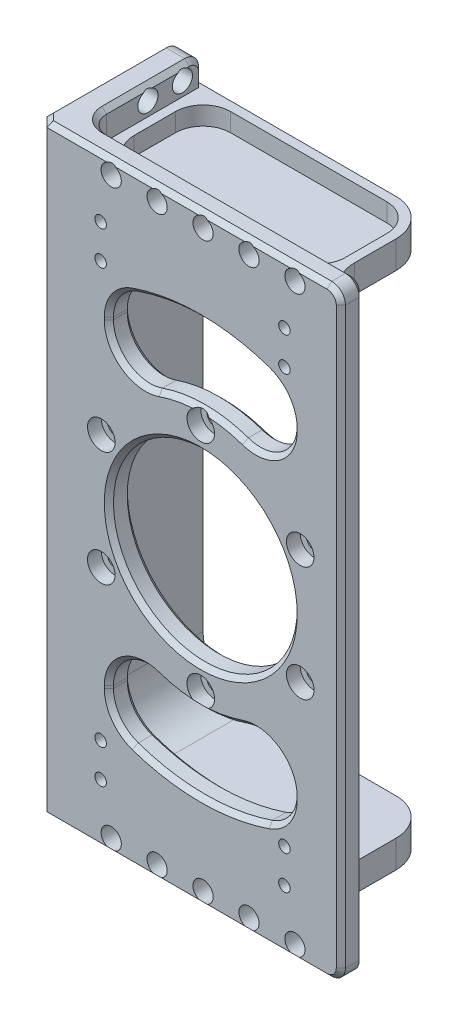
from build123d import *

# Parameters (mm, degrees)
SKETCH_1_W                  = 60
SKETCH_1_H                  = 131
EXTRUDE_1_DEPTH             = 5
SKETCH_2_W                  = 30
SKETCH_2_H                  = 131
EXTRUDE_2_DEPTH             = 6
SKETCH_3_R                  = 20
CUT_EXTRUDE_1_DEPTH         = 10
CHAMFER_1_SIZE              = 2
FILLET_1_R                  = 3
SKETCH_13_R                 = 1.6
CUT_EXTRUDE_2_DEPTH         = 6
SKETCH_14_R                 = 3
CUT_EXTRUDE_3_DEPTH         = 3
CHAMFER_4_SIZE              = 1
SKETCH_16_W                 = 50
SKETCH_16_H                 = 6
EXTRUDE_4_DEPTH             = 25
FILLET_3_R                  = 4
FILLET_4_R                  = 10
FILLET_5_R                  = 8
CUT_EXTRUDE_4_DEPTH         = 4
FILLET_6_R                  = 6
SKETCH_19_R                 = 2.2
CUT_EXTRUDE_5_DEPTH         = 18
SKETCH_20_R                 = 2.2
CUT_EXTRUDE_6_DEPTH         = 18
HOLE_WIZARD_M3_1_AT_2_COUNT = 2
HOLE_WIZARD_M3_1_AT_2_PITCH = 40
HOLE_WIZARD_M3_1_AT_3_COUNT = 2
HOLE_WIZARD_M3_1_AT_3_PITCH = 105.617529322
HOLE_WIZARD_M3_1_AT_4_COUNT = 2
HOLE_WIZARD_M3_1_AT_4_PITCH = 97.75
HOLE_WIZARD_M3_2_D          = 2.5
HOLE_WIZARD_M3_2_DEPTH      = 7.5
HOLE_WIZARD_M3_2_TIP        = 0.751075774
CUT_EXTRUDE_7_DEPTH         = 10
FILLET_7_R                  = 8
CHAMFER_5_SIZE              = 1
CHAMFER_6_SIZE              = 1


# Some blends are built 0.0001 mm under size
with BuildPart() as part:
    # 草图1 → 凸台-拉伸1 (new body)
    with BuildSketch(Plane.XY):
        with Locations((-207.175860782, 60.5)):
            Rectangle(SKETCH_1_W, SKETCH_1_H)
    extrude(amount=EXTRUDE_1_DEPTH)

    # 草图2 → 凸台-拉伸2 (add)
    with BuildSketch(Plane.ZY.offset(237.175860782)):
        with Locations((-10, 60.5)):
            Rectangle(SKETCH_2_W, SKETCH_2_H)
    extrude(amount=EXTRUDE_2_DEPTH)

    # 草图3 → 切除-拉伸1 (cut)
    with BuildSketch(Plane.XY.offset(5)):
        with Locations((-207.675860782, 60.5)):
            Circle(SKETCH_3_R)
    extrude(amount=-CUT_EXTRUDE_1_DEPTH, mode=Mode.SUBTRACT)

    # 倒角1
    chamfer_1_edges = [part.edges().sort_by_distance(p)[0] for p in [
        (-243.175860782, 60.5, 5),
    ]]
    chamfer(chamfer_1_edges, length=CHAMFER_1_SIZE)

    # 圆角1
    fillet_1_edges = [part.edges().sort_by_distance(p)[0] for p in [
        (-240.175860782, 126, -25),
        (-240.175860782, -5, -25),
        (-177.175860782, 126, 2.5),
        (-177.175860782, -5, 2.5),
    ]]
    fillet(fillet_1_edges, radius=FILLET_1_R)

    # 草图13 → 切除-拉伸2 (cut)
    with BuildSketch(Plane.XY.offset(5)):
        with Locations((-207.675860782, 85.5)):
            Circle(SKETCH_13_R)
        with Locations((-229.326495877, 73)):
            Circle(SKETCH_13_R)
        with Locations((-186.025225688, 73)):
            Circle(SKETCH_13_R)
        with Locations((-186.025225688, 48)):
            Circle(SKETCH_13_R)
        with Locations((-207.675860782, 35.5)):
            Circle(SKETCH_13_R)
        with Locations((-229.326495877, 48)):
            Circle(SKETCH_13_R)
    extrude(amount=-CUT_EXTRUDE_2_DEPTH, mode=Mode.SUBTRACT)

    # 草图14 → 切除-拉伸3 (cut)
    with BuildSketch(Plane.XY.offset(5)):
        with Locations((-207.675860782, 85.5)):
            Circle(SKETCH_14_R)
        with Locations((-186.025225688, 73)):
            Circle(SKETCH_14_R)
        with Locations((-186.025225688, 48)):
            Circle(SKETCH_14_R)
        with Locations((-207.675860782, 35.5)):
            Circle(SKETCH_14_R)
        with Locations((-229.326495877, 48)):
            Circle(SKETCH_14_R)
        with Locations((-229.326495877, 73)):
            Circle(SKETCH_14_R)
    extrude(amount=-CUT_EXTRUDE_3_DEPTH, mode=Mode.SUBTRACT)

    # 倒角4
    chamfer_4_edges = [part.edges().sort_by_distance(p)[0] for p in [
        (-243.175860782, 126, -9.5),
        (-242.175860782, 126, 4),
        (-210.675860782, -5, 5),
        (-242.175860782, -5, 4),
        (-243.175860782, 60.5, -25),
        (-210.675860782, 126, 5),
        (-243.175860782, -5, -9.5),
        (-243.175860782, -4.121320344, -24.121320344),
        (-243.175860782, 125.121320344, -24.121320344),
        (-177.175860782, 60.5, 5),
        (-178.054540439, -4.121320344, 5),
        (-178.054540439, 125.121320344, 5),
    ]]
    chamfer(chamfer_4_edges, length=CHAMFER_4_SIZE)

    # 草图16 → 凸台-拉伸4 (add)
    with BuildSketch(Plane(origin=(0, 0, 0), x_dir=(-1, 0, 0), z_dir=(0, 0, -1))):
        with Locations((212.175860782, 117)):
            Rectangle(SKETCH_16_W, SKETCH_16_H)
    extrude_4 = extrude(amount=EXTRUDE_4_DEPTH)

    # 镜向1: 凸台-拉伸4 across plane
    add(extrude_4.mirror(Plane(origin=(0, 60.5, 0), x_dir=(0, 0, 1), z_dir=(0, -1, 0))))

    # 圆角3
    fillet_3_edges = [part.edges().sort_by_distance(p)[0] for p in [
        (-237.175860782, -2, 0),
        (-237.175860782, 123, 0),
    ]]
    fillet(fillet_3_edges, radius=FILLET_3_R)

    # 圆角4
    fillet_4_edges = [part.edges().sort_by_distance(p)[0] for p in [
        (-237.175860782, 114, -12.5),
        (-237.175860782, 7, -12.5),
    ]]
    fillet(fillet_4_edges, radius=FILLET_4_R)

    # 圆角5
    fillet_5_edges = [part.edges().sort_by_distance(p)[0] for p in [
        (-187.175860782, 117, -25),
        (-187.175860782, 117, 0),
        (-187.175860782, 4, 0),
        (-187.175860782, 4, -25),
    ]]
    fillet(fillet_5_edges, radius=FILLET_5_R)

    # 草图17 → 切除-拉伸4 (cut)
    with BuildSketch(Plane(origin=(0, 120, 0), x_dir=(1, 0, 0), z_dir=(0, 1, 0))):
        with BuildLine():
            Line((-235.175860782, 4), (-235.175860782, 2))
            Line((-235.175860782, 2), (-233.175860782, 2))
            Line((-233.175860782, 2), (-187.175860782, 2))
            ThreePointArc((-187.175860782, 2), (-188.662693763, 4.83772234), (-189.175860782, 8))
            Line((-189.175860782, 8), (-189.175860782, 17))
            ThreePointArc((-189.175860782, 17), (-190.933220095, 21.242640687), (-195.175860782, 23))
            Line((-195.175860782, 23), (-235.175860782, 23))
            Line((-235.175860782, 23), (-235.175860782, 4))
        make_face()
    cut_extrude_4 = extrude(amount=-CUT_EXTRUDE_4_DEPTH, mode=Mode.SUBTRACT)

    # 镜向2: 切除-拉伸4 across plane
    add(cut_extrude_4.mirror(Plane(origin=(0, 60.5, 0), x_dir=(0, 0, 1), z_dir=(0, -1, 0))), mode=Mode.SUBTRACT)

    # 圆角6
    fillet_6_edges = [part.edges().sort_by_distance(p)[0] for p in [
        (-187.175860782, 118, -2),
        (-235.175860782, 118, -23),
        (-235.175860782, 118, -2),
        (-235.175860782, 3, -23),
        (-187.175860782, 3, -2),
        (-235.175860782, 3, -2),
    ]]
    fillet(fillet_6_edges, radius=FILLET_6_R - 0.0001)  # a hair under: the kernel refuses the full size

    # 草图19 → 切除-拉伸5 (cut)
    with BuildSketch(Plane.XY.offset(5)):
        with Locations((-217.175860782, -2)):
            Circle(SKETCH_19_R)
        with Locations((-187.175860782, -2)):
            Circle(SKETCH_19_R)
        with Locations((-197.175860782, -2)):
            Circle(SKETCH_19_R)
        with Locations((-207.175860782, -2)):
            Circle(SKETCH_19_R)
        with Locations((-227.175860782, -2)):
            Circle(SKETCH_19_R)
    cut_extrude_5 = extrude(amount=-CUT_EXTRUDE_5_DEPTH, mode=Mode.SUBTRACT)

    # 镜向3: 切除-拉伸5 across plane
    add(cut_extrude_5.mirror(Plane(origin=(0, 60.5, 0), x_dir=(0, 0, 1), z_dir=(0, -1, 0))), mode=Mode.SUBTRACT)

    # 草图20 → 切除-拉伸6 (cut)
    with BuildSketch(Plane.ZY.offset(243.175860782)):
        with Locations((-20.5, -2)):
            Circle(SKETCH_20_R)
        with Locations((-13, -2)):
            Circle(SKETCH_20_R)
    cut_extrude_6 = extrude(amount=-CUT_EXTRUDE_6_DEPTH, mode=Mode.SUBTRACT)

    # 镜向4: 切除-拉伸6 across plane
    add(cut_extrude_6.mirror(Plane(origin=(0, 60.5, 0), x_dir=(0, 0, 1), z_dir=(0, -1, 0))), mode=Mode.SUBTRACT)

    # 草图23 → M3 螺纹孔1 (revolve, cut)
    with BuildSketch(Plane(origin=(-229.465860782, 113.065, 5), x_dir=(0, -1, 0), z_dir=(1, 0, 0))):
        Polygon((0, 0), (0, 8.251075774), (1.25, 7.5), (1.25, 0), align=None)
    hole_wizard_m3_1 = revolve(axis=Axis((-229.465860782, 113.065, 11.35), (0, 0, -1)), mode=Mode.SUBTRACT)

    # M3 螺纹孔1 at 2: M3 螺纹孔1 ×2
    with Locations(*[(i * HOLE_WIZARD_M3_1_AT_2_PITCH, 0, 0) for i in range(1, HOLE_WIZARD_M3_1_AT_2_COUNT)]):
        add(hole_wizard_m3_1, mode=Mode.SUBTRACT)

    # M3 螺纹孔1 at 3: M3 螺纹孔1 ×2
    with Locations(*[Vector(0.3787250114344214, -0.9255092466928666, 0) * (i * HOLE_WIZARD_M3_1_AT_3_PITCH) for i in range(1, HOLE_WIZARD_M3_1_AT_3_COUNT)]):
        add(hole_wizard_m3_1, mode=Mode.SUBTRACT)

    # M3 螺纹孔1 at 4: M3 螺纹孔1 ×2
    with Locations(*[(0, -i * HOLE_WIZARD_M3_1_AT_4_PITCH, 0) for i in range(1, HOLE_WIZARD_M3_1_AT_4_COUNT)]):
        add(hole_wizard_m3_1, mode=Mode.SUBTRACT)

    # 镜向5: M3 螺纹孔1 across plane
    add(hole_wizard_m3_1.mirror(Plane(origin=(0, 60.5, 0), x_dir=(0, 0, 1), z_dir=(0, -1, 0))), mode=Mode.SUBTRACT)

    # 镜向5 copy 1 sketch → 镜向5 copy 1 (revolve, cut)
    with BuildSketch(Plane(origin=(-189.465860782, 7.935, 5), x_dir=(0, 1, 0), z_dir=(1, 0, 0))):
        Polygon((0, 0), (0, -8.251075774), (1.25, -7.5), (1.25, 0), align=None)
    revolve(axis=Axis((-189.465860782, 7.935, 11.35), (0, 0, 1)), mode=Mode.SUBTRACT)

    # 镜向5 copy 2 sketch → 镜向5 copy 2 (revolve, cut)
    with BuildSketch(Plane(origin=(-189.465860782, 105.685, 5), x_dir=(0, 1, 0), z_dir=(1, 0, 0))):
        Polygon((0, 0), (0, -8.251075774), (1.25, -7.5), (1.25, 0), align=None)
    revolve(axis=Axis((-189.465860782, 105.685, 11.35), (0, 0, 1)), mode=Mode.SUBTRACT)

    # 镜向5 copy 3 sketch → 镜向5 copy 3 (revolve, cut)
    with BuildSketch(Plane(origin=(-229.465860782, 105.685, 5), x_dir=(0, 1, 0), z_dir=(1, 0, 0))):
        Polygon((0, 0), (0, -8.251075774), (1.25, -7.5), (1.25, 0), align=None)
    revolve(axis=Axis((-229.465860782, 105.685, 11.35), (0, 0, 1)), mode=Mode.SUBTRACT)

    # M3 螺纹孔2
    with Locations(Plane.ZY.offset(243.175860782)):
        with Locations((-7.12, 85.8), (-7.12, 35.2)):
            Hole(HOLE_WIZARD_M3_2_D / 2, depth=HOLE_WIZARD_M3_2_DEPTH)
            with Locations((0, 0, -(HOLE_WIZARD_M3_2_DEPTH + HOLE_WIZARD_M3_2_TIP / 2))):  # 118° drill point
                Cone(0, HOLE_WIZARD_M3_2_D / 2, HOLE_WIZARD_M3_2_TIP, mode=Mode.SUBTRACT)

    # 草图27 → 切除-拉伸7 (cut)
    with BuildSketch(Plane(origin=(0, 0, 0), x_dir=(-1, 0, 0), z_dir=(0, 0, -1))):
        with BuildLine():
            Line((187.675860782, 100.811288741), (187.675860782, 80.803940504))
            ThreePointArc((187.675860782, 80.803940504), (207.675860782, 89), (227.675860782, 80.803940504))
            Line((227.675860782, 80.803940504), (227.675860782, 100.811288741))
            ThreePointArc((227.675860782, 100.811288741), (207.675860782, 105.5), (187.675860782, 100.811288741))
        make_face()
        with BuildLine():
            Line((187.675860782, 40.196059496), (187.675860782, 20.188711259))
            ThreePointArc((187.675860782, 20.188711259), (207.675860782, 15.5), (227.675860782, 20.188711259))
            Line((227.675860782, 20.188711259), (227.675860782, 40.196059496))
            ThreePointArc((227.675860782, 40.196059496), (207.675860782, 32), (187.675860782, 40.196059496))
        make_face()
    extrude(amount=-CUT_EXTRUDE_7_DEPTH, mode=Mode.SUBTRACT)

    # 圆角7
    fillet_7_edges = [part.edges().sort_by_distance(p)[0] for p in [
        (-227.675860782, 80.803940504, 2.5),
        (-187.675860782, 80.803940504, 2.5),
        (-187.675860782, 100.811288741, 2.5),
        (-227.675860782, 100.811288741, 2.5),
        (-227.675860782, 20.188711259, 2.5),
        (-187.675860782, 20.188711259, 2.5),
        (-187.675860782, 40.196059496, 2.5),
        (-227.675860782, 40.196059496, 2.5),
    ]]
    fillet(fillet_7_edges, radius=FILLET_7_R)

    # 倒角5
    # the kernel refuses this chamfer: 1 mm, written as the material it takes off along each edge
    with BuildSketch(Plane(origin=(-207.675860782, 60.5, 0), x_dir=(1, 0, 0), z_dir=(0, -1, 0))) as chamfer_5_piece_1:
        Polygon((20 + CHAMFER_5_SIZE, 0), (20, CHAMFER_5_SIZE), (20, 0), align=None)
    revolve(axis=Axis((-207.675860782, 60.5, 0), (0, 0, 1)), mode=Mode.SUBTRACT)
    with BuildSketch(Plane(origin=(-207.675860782, 60.5, 5), x_dir=(1, 0, 0), z_dir=(0, -1, 0))) as chamfer_5_piece_2:
        Polygon((20, -CHAMFER_5_SIZE), (20 + CHAMFER_5_SIZE, 0), (20, 0), align=None)
    revolve(axis=Axis((-207.675860782, 60.5, 5), (0, 0, 1)), mode=Mode.SUBTRACT)
    with BuildSketch(Plane(origin=(-207.675860782, 60.5, 5), x_dir=(0.3243243243243247, -0.9459459459459458, 0), z_dir=(0.9459459459459458, 0.3243243243243247, 0))) as chamfer_5_piece_3:
        Polygon((45, CHAMFER_5_SIZE), (45 + CHAMFER_5_SIZE, 0), (45, 0), align=None)
    revolve(axis=Axis((-207.675860782, 60.5, 5), (0, 0, -1)), revolution_arc=37.849288832, mode=Mode.SUBTRACT)
    with BuildSketch(Plane(origin=(-207.675860782, 60.5, 0), x_dir=(0.3243243243243247, -0.9459459459459458, 0), z_dir=(0.9459459459459458, 0.3243243243243247, 0))) as chamfer_5_piece_4:
        Polygon((45 + CHAMFER_5_SIZE, 0), (45, -CHAMFER_5_SIZE), (45, 0), align=None)
    revolve(axis=Axis((-207.675860782, 60.5, 0), (0, 0, -1)), revolution_arc=37.849288832, mode=Mode.SUBTRACT)
    with BuildSketch(Plane(origin=(-187.675860782, 26.028997694, 5), x_dir=(-0.02749587661058217, 0, -0.9996219169112968), z_dir=(0, -1, 0)), Plane(origin=(-187.675860782, 26.028997694, 0), x_dir=(0.9996219169112968, 0, -0.027495876610586483), z_dir=(0, -1, 0)), Plane(origin=(-227.675860782, 25.5, 5), x_dir=(0.02749587661058217, 0, -0.9996219169112968), z_dir=(0, 1, 0)), Plane(origin=(-227.675860782, 25.5, 0), x_dir=(-0.9996219169112968, 0, -0.027495876610586483), z_dir=(0, 1, 0)), Plane(origin=(-187.675860782, 95.5, 5), x_dir=(-0.02749587661058217, 0, -0.9996219169112968), z_dir=(0, -1, 0)), Plane(origin=(-187.675860782, 95.5, 0), x_dir=(0.9996219169112968, 0, -0.027495876610586483), z_dir=(0, -1, 0)), Plane(origin=(-227.675860782, 94.971002306, 5), x_dir=(0.02749587661058217, 0, -0.9996219169112968), z_dir=(0, 1, 0)), Plane(origin=(-227.675860782, 94.971002306, 0), x_dir=(-0.9996219169112968, 0, -0.027495876610586483), z_dir=(0, 1, 0))) as chamfer_5_piece_5:
        Polygon((CHAMFER_5_SIZE * 0.999621916911, CHAMFER_5_SIZE * 0.0274958766106), (-CHAMFER_5_SIZE * 0.0274958766106, CHAMFER_5_SIZE * 0.999621916911), (0, 0), align=None)
    extrude(amount=0.528997694, mode=Mode.SUBTRACT)
    with BuildSketch(Plane(origin=(-207.675860782, 60.5, 5), x_dir=(0.3287671232876714, -0.9444110220900375, 0), z_dir=(0.9444110220900375, 0.3287671232876714, 0))) as chamfer_5_piece_6:
        Polygon((28.5, CHAMFER_5_SIZE), (28.5 - CHAMFER_5_SIZE, 0), (28.5, 0), align=None)
    revolve(axis=Axis((-207.675860782, 60.5, 5), (0, 0, -1)), revolution_arc=38.387923948, mode=Mode.SUBTRACT)
    with BuildSketch(Plane(origin=(-207.675860782, 60.5, 0), x_dir=(-0.3287671232876714, -0.9444110220900375, 0), z_dir=(-0.9444110220900375, 0.3287671232876714, 0))) as chamfer_5_piece_7:
        Polygon((28.5 - CHAMFER_5_SIZE, 0), (28.5, CHAMFER_5_SIZE), (28.5, 0), align=None)
    revolve(axis=Axis((-207.675860782, 60.5, 0), (0, 0, 1)), revolution_arc=38.387923948, mode=Mode.SUBTRACT)
    with BuildSketch(Plane(origin=(-207.675860782, 60.5, 5), x_dir=(-0.3287671232876707, 0.9444110220900377, 0), z_dir=(-0.9444110220900377, -0.3287671232876707, 0))) as chamfer_5_piece_8:
        Polygon((28.5, CHAMFER_5_SIZE), (28.5 - CHAMFER_5_SIZE, 0), (28.5, 0), align=None)
    revolve(axis=Axis((-207.675860782, 60.5, 5), (0, 0, -1)), revolution_arc=38.387923948, mode=Mode.SUBTRACT)
    with BuildSketch(Plane(origin=(-207.675860782, 60.5, 0), x_dir=(0.3287671232876697, 0.944411022090038, 0), z_dir=(0.944411022090038, -0.3287671232876697, 0))) as chamfer_5_piece_9:
        Polygon((28.5 - CHAMFER_5_SIZE, 0), (28.5, CHAMFER_5_SIZE), (28.5, 0), align=None)
    revolve(axis=Axis((-207.675860782, 60.5, 0), (0, 0, 1)), revolution_arc=38.387923948, mode=Mode.SUBTRACT)
    with BuildSketch(Plane(origin=(-207.675860782, 60.5, 5), x_dir=(-0.32432432432432445, 0.9459459459459459, 0), z_dir=(-0.9459459459459459, -0.32432432432432445, 0))) as chamfer_5_piece_10:
        Polygon((45, CHAMFER_5_SIZE), (45 + CHAMFER_5_SIZE, 0), (45, 0), align=None)
    revolve(axis=Axis((-207.675860782, 60.5, 5), (0, 0, -1)), revolution_arc=37.849288832, mode=Mode.SUBTRACT)
    with BuildSketch(Plane(origin=(-207.675860782, 60.5, 0), x_dir=(-0.32432432432432434, 0.9459459459459459, 0), z_dir=(-0.9459459459459459, -0.32432432432432434, 0))) as chamfer_5_piece_11:
        Polygon((45 + CHAMFER_5_SIZE, 0), (45, -CHAMFER_5_SIZE), (45, 0), align=None)
    revolve(axis=Axis((-207.675860782, 60.5, 0), (0, 0, -1)), revolution_arc=37.849288832, mode=Mode.SUBTRACT)
    with BuildSketch(Plane(origin=(-195.675860782, 25.5, 0), x_dir=(1, 0, 0), z_dir=(0, 1, 0))) as chamfer_5_piece_12:
        Polygon((8 + CHAMFER_5_SIZE, 0), (8, -CHAMFER_5_SIZE), (8, 0), align=None)
    revolve(axis=Axis((-195.675860782, 25.5, 0), (0, 0, -1)), revolution_arc=71.075355584, mode=Mode.SUBTRACT)
    with BuildSketch(Plane(origin=(-195.675860782, 25.5, 5), x_dir=(1, 0, 0), z_dir=(0, 1, 0))) as chamfer_5_piece_13:
        Polygon((8, CHAMFER_5_SIZE), (8 + CHAMFER_5_SIZE, 0), (8, 0), align=None)
    revolve(axis=Axis((-195.675860782, 25.5, 5), (0, 0, -1)), revolution_arc=71.075355584, mode=Mode.SUBTRACT)
    with BuildSketch(Plane(origin=(-219.675860782, 26.028997694, 0), x_dir=(-1, 0, 0), z_dir=(0, -1, 0))) as chamfer_5_piece_14:
        Polygon((8 + CHAMFER_5_SIZE, 0), (8, -CHAMFER_5_SIZE), (8, 0), align=None)
    revolve(axis=Axis((-219.675860782, 26.028997694, 0), (0, 0, -1)), revolution_arc=109.193961974, mode=Mode.SUBTRACT)
    with BuildSketch(Plane(origin=(-219.675860782, 26.028997694, 5), x_dir=(-1, 0, 0), z_dir=(0, -1, 0))) as chamfer_5_piece_15:
        Polygon((8, CHAMFER_5_SIZE), (8 + CHAMFER_5_SIZE, 0), (8, 0), align=None)
    revolve(axis=Axis((-219.675860782, 26.028997694, 5), (0, 0, -1)), revolution_arc=109.193961974, mode=Mode.SUBTRACT)
    with BuildSketch(Plane(origin=(-219.675860782, 25.5, 0), x_dir=(-0.3243243243243228, -0.9459459459459465, 0), z_dir=(0.9459459459459465, -0.3243243243243228, 0))) as chamfer_5_piece_16:
        Polygon((8 + CHAMFER_5_SIZE, 0), (8, -CHAMFER_5_SIZE), (8, 0), align=None)
    revolve(axis=Axis((-219.675860782, 25.5, 0), (0, 0, -1)), revolution_arc=71.075355584, mode=Mode.SUBTRACT)
    with BuildSketch(Plane(origin=(-219.675860782, 25.5, 5), x_dir=(-0.3243243243243228, -0.9459459459459465, 0), z_dir=(0.9459459459459465, -0.3243243243243228, 0))) as chamfer_5_piece_17:
        Polygon((8, CHAMFER_5_SIZE), (8 + CHAMFER_5_SIZE, 0), (8, 0), align=None)
    revolve(axis=Axis((-219.675860782, 25.5, 5), (0, 0, -1)), revolution_arc=71.075355584, mode=Mode.SUBTRACT)
    with BuildSketch(Plane(origin=(-195.675860782, 26.028997694, 0), x_dir=(1, 0, 0), z_dir=(0, -1, 0))) as chamfer_5_piece_18:
        Polygon((8 + CHAMFER_5_SIZE, 0), (8, CHAMFER_5_SIZE), (8, 0), align=None)
    revolve(axis=Axis((-195.675860782, 26.028997694, 0), (0, 0, 1)), revolution_arc=109.193961974, mode=Mode.SUBTRACT)
    with BuildSketch(Plane(origin=(-195.675860782, 26.028997694, 5), x_dir=(1, 0, 0), z_dir=(0, -1, 0))) as chamfer_5_piece_19:
        Polygon((8, -CHAMFER_5_SIZE), (8 + CHAMFER_5_SIZE, 0), (8, 0), align=None)
    revolve(axis=Axis((-195.675860782, 26.028997694, 5), (0, 0, 1)), revolution_arc=109.193961974, mode=Mode.SUBTRACT)
    with BuildSketch(Plane(origin=(-195.675860782, 94.971002306, 0), x_dir=(1, 0, 0), z_dir=(0, 1, 0))) as chamfer_5_piece_20:
        Polygon((8 + CHAMFER_5_SIZE, 0), (8, -CHAMFER_5_SIZE), (8, 0), align=None)
    revolve(axis=Axis((-195.675860782, 94.971002306, 0), (0, 0, -1)), revolution_arc=109.193961974, mode=Mode.SUBTRACT)
    with BuildSketch(Plane(origin=(-195.675860782, 94.971002306, 5), x_dir=(1, 0, 0), z_dir=(0, 1, 0))) as chamfer_5_piece_21:
        Polygon((8, CHAMFER_5_SIZE), (8 + CHAMFER_5_SIZE, 0), (8, 0), align=None)
    revolve(axis=Axis((-195.675860782, 94.971002306, 5), (0, 0, -1)), revolution_arc=109.193961974, mode=Mode.SUBTRACT)
    with BuildSketch(Plane(origin=(-219.675860782, 95.5, 0), x_dir=(-1, 0, 0), z_dir=(0, -1, 0))) as chamfer_5_piece_22:
        Polygon((8 + CHAMFER_5_SIZE, 0), (8, -CHAMFER_5_SIZE), (8, 0), align=None)
    revolve(axis=Axis((-219.675860782, 95.5, 0), (0, 0, -1)), revolution_arc=71.075355584, mode=Mode.SUBTRACT)
    with BuildSketch(Plane(origin=(-219.675860782, 95.5, 5), x_dir=(-1, 0, 0), z_dir=(0, -1, 0))) as chamfer_5_piece_23:
        Polygon((8, CHAMFER_5_SIZE), (8 + CHAMFER_5_SIZE, 0), (8, 0), align=None)
    revolve(axis=Axis((-219.675860782, 95.5, 5), (0, 0, -1)), revolution_arc=71.075355584, mode=Mode.SUBTRACT)
    with BuildSketch(Plane(origin=(-219.675860782, 94.971002306, 0), x_dir=(0.32876712328767255, -0.944411022090037, 0), z_dir=(0.944411022090037, 0.32876712328767255, 0))) as chamfer_5_piece_24:
        Polygon((8 + CHAMFER_5_SIZE, 0), (8, -CHAMFER_5_SIZE), (8, 0), align=None)
    revolve(axis=Axis((-219.675860782, 94.971002306, 0), (0, 0, -1)), revolution_arc=109.193961974, mode=Mode.SUBTRACT)
    with BuildSketch(Plane(origin=(-219.675860782, 94.971002306, 5), x_dir=(0.32876712328767255, -0.944411022090037, 0), z_dir=(0.944411022090037, 0.32876712328767255, 0))) as chamfer_5_piece_25:
        Polygon((8, CHAMFER_5_SIZE), (8 + CHAMFER_5_SIZE, 0), (8, 0), align=None)
    revolve(axis=Axis((-219.675860782, 94.971002306, 5), (0, 0, -1)), revolution_arc=109.193961974, mode=Mode.SUBTRACT)
    with BuildSketch(Plane(origin=(-195.675860782, 95.5, 0), x_dir=(1, 0, 0), z_dir=(0, -1, 0))) as chamfer_5_piece_26:
        Polygon((8 + CHAMFER_5_SIZE, 0), (8, CHAMFER_5_SIZE), (8, 0), align=None)
    revolve(axis=Axis((-195.675860782, 95.5, 0), (0, 0, 1)), revolution_arc=71.075355584, mode=Mode.SUBTRACT)
    with BuildSketch(Plane(origin=(-195.675860782, 95.5, 5), x_dir=(1, 0, 0), z_dir=(0, -1, 0))) as chamfer_5_piece_27:
        Polygon((8, -CHAMFER_5_SIZE), (8 + CHAMFER_5_SIZE, 0), (8, 0), align=None)
    revolve(axis=Axis((-195.675860782, 95.5, 5), (0, 0, 1)), revolution_arc=71.075355584, mode=Mode.SUBTRACT)

    # 倒角6
    # the kernel refuses this chamfer: 1 mm, written as the material it takes off along each edge
    with BuildSketch(Plane(origin=(-237.175860782, -2, -25), x_dir=(-0.9996219169112968, 0, -0.02749587661058574), z_dir=(0, 1, 0)), Plane(origin=(-237.175860782, 120, -25), x_dir=(-0.9996219169112968, 0, -0.02749587661058574), z_dir=(0, 1, 0))) as chamfer_6_piece_1:
        Polygon((CHAMFER_6_SIZE * 0.999621916911, CHAMFER_6_SIZE * 0.0274958766106), (-CHAMFER_6_SIZE * 0.0274958766106, CHAMFER_6_SIZE * 0.999621916911), (0, 0), align=None)
    extrude(amount=3, mode=Mode.SUBTRACT)
    with BuildSketch(Plane(origin=(-180.175860782, -5, 0), x_dir=(0, 0.9996219169112968, -0.027495876610586365), z_dir=(-1, 0, 0)), Plane(origin=(-233.175860782, 126, 0), x_dir=(0, -0.9996219169112968, -0.027495876610586483), z_dir=(1, 0, 0))) as chamfer_6_piece_2:
        Polygon((CHAMFER_6_SIZE * 0.999621916911, -CHAMFER_6_SIZE * 0.0274958766106), (-CHAMFER_6_SIZE * 0.0274958766106, -CHAMFER_6_SIZE * 0.999621916911), (0, 0), align=None)
    extrude(amount=53, mode=Mode.SUBTRACT)
    with BuildSketch(Plane(origin=(-237.175860782, 126, -22), x_dir=(-0.999621916911297, 0.027495876610582292, 0), z_dir=(0, 0, 1)), Plane(origin=(-237.175860782, -5, -4), x_dir=(-0.9996219169112968, -0.02749587661058574, 0), z_dir=(0, 0, -1))) as chamfer_6_piece_3:
        Polygon((CHAMFER_6_SIZE * 0.999621916911, CHAMFER_6_SIZE * 0.0274958766106), (-CHAMFER_6_SIZE * 0.0274958766106, CHAMFER_6_SIZE * 0.999621916911), (0, 0), align=None)
    extrude(amount=18, mode=Mode.SUBTRACT)
    with BuildSketch(Plane(origin=(-233.175860782, -5, -4), x_dir=(0, 0, 1), z_dir=(1, 0, 0))) as chamfer_6_piece_4:
        Polygon((4 + CHAMFER_6_SIZE, 0), (4, -CHAMFER_6_SIZE), (4, 0), align=None)
    revolve(axis=Axis((-233.175860782, -5, -4), (0, -1, 0)), revolution_arc=90, mode=Mode.SUBTRACT)
    with BuildSketch(Plane(origin=(-233.175860782, 126, -4), x_dir=(-1, 0, 0), z_dir=(0, 0, -1))) as chamfer_6_piece_5:
        Polygon((4, -CHAMFER_6_SIZE), (4 + CHAMFER_6_SIZE, 0), (4, 0), align=None)
    revolve(axis=Axis((-233.175860782, 126, -4), (0, 1, 0)), revolution_arc=90, mode=Mode.SUBTRACT)
    with BuildSketch(Plane(origin=(-237.175860782, -2, -22), x_dir=(0, 0, -1), z_dir=(0, 1, 0))) as chamfer_6_piece_6:
        Polygon((3 - CHAMFER_6_SIZE, 0), (3, CHAMFER_6_SIZE), (3, 0), align=None)
    revolve(axis=Axis((-237.175860782, -2, -22), (-1, 0, 0)), revolution_arc=90, mode=Mode.SUBTRACT)
    with BuildSketch(Plane(origin=(-237.175860782, 123, -22), x_dir=(0, 1, 0), z_dir=(0, 0, 1))) as chamfer_6_piece_7:
        Polygon((3 - CHAMFER_6_SIZE, 0), (3, CHAMFER_6_SIZE), (3, 0), align=None)
    revolve(axis=Axis((-237.175860782, 123, -22), (-1, 0, 0)), revolution_arc=90, mode=Mode.SUBTRACT)
    with BuildSketch(Plane(origin=(-177.175860782, 123, 0), x_dir=(-0.9996219169112968, 0, -0.027495876610586483), z_dir=(0, -1, 0))) as chamfer_6_piece_8:
        Polygon((CHAMFER_6_SIZE * 0.999621916911, -CHAMFER_6_SIZE * 0.0274958766106), (-CHAMFER_6_SIZE * 0.0274958766106, -CHAMFER_6_SIZE * 0.999621916911), (0, 0), align=None)
    extrude(amount=125, mode=Mode.SUBTRACT)
    with BuildSketch(Plane(origin=(-180.175860782, -2, 0), x_dir=(1, 0, 0), z_dir=(0, 1, 0))) as chamfer_6_piece_9:
        Polygon((3 - CHAMFER_6_SIZE, 0), (3, -CHAMFER_6_SIZE), (3, 0), align=None)
    revolve(axis=Axis((-180.175860782, -2, 0), (0, 0, -1)), revolution_arc=90, mode=Mode.SUBTRACT)
    with BuildSketch(Plane(origin=(-180.175860782, 123, 0), x_dir=(0, 1, 0), z_dir=(-1, 0, 0))) as chamfer_6_piece_10:
        Polygon((3 - CHAMFER_6_SIZE, 0), (3, -CHAMFER_6_SIZE), (3, 0), align=None)
    revolve(axis=Axis((-180.175860782, 123, 0), (0, 0, -1)), revolution_arc=90, mode=Mode.SUBTRACT)


solid = part.part
